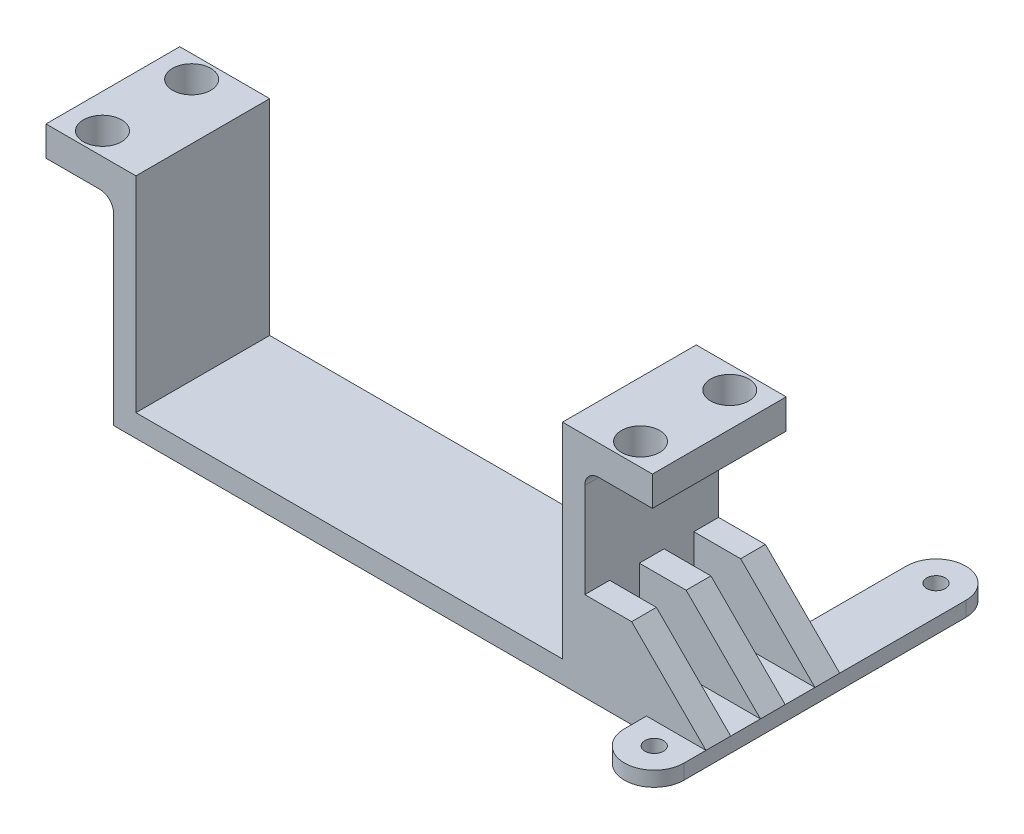
from build123d import *

# Parameters (mm, degrees)
BOSS_EXTRUDE1_DEPTH = 22.86
SKETCH2_R           = 1.5875
BOSS_EXTRUDE2_DEPTH = 2.54
SKETCH4_W           = 15.367
SKETCH4_H           = 22.86
SKETCH4_R           = 3.2639
BOSS_EXTRUDE3_DEPTH = 5.08
SKETCH5_W           = 20.701
SKETCH5_H           = 4.233333333
SKETCH5_H_2         = 4.233333334
BOSS_EXTRUDE4_DEPTH = 12.7
CHAMFER1_SIZE       = 12.7
FILLET1_R           = 2.38


with BuildPart() as part:
    # Sketch1 → Boss-Extrude1 (new body)
    with BuildSketch(Plane.XY):
        Polygon((-3.81, 35.052), (0, 35.052), (0, 0), (72.898, 0), (72.898, 35.052), (76.708, 35.052), (76.708, -3.81), (-3.81, -3.81), align=None)
    extrude(amount=BOSS_EXTRUDE1_DEPTH)

    # Sketch2 → Boss-Extrude2 (add)
    with BuildSketch(Plane.XZ.offset(3.81)):
        with BuildLine():
            Line((87.249, 26.6192), (87.249, 22.86))
            Line((87.249, 22.86), (76.708, 22.86))
            Line((76.708, 22.86), (76.708, 0))
            Line((76.708, 0), (87.249, 0))
            Line((87.249, 0), (87.249, -21.5392))
            ThreePointArc((87.249, -21.5392), (92.329, -26.6192), (97.409, -21.5392))
            Line((97.409, -21.5392), (97.409, 26.6192))
            ThreePointArc((97.409, 26.6192), (92.329, 31.6992), (87.249, 26.6192))
        make_face()
        with Locations((92.329, 26.6192)):
            Circle(SKETCH2_R, mode=Mode.SUBTRACT)
        with Locations((92.329, -21.5392)):
            Circle(SKETCH2_R, mode=Mode.SUBTRACT)
    extrude(amount=-BOSS_EXTRUDE2_DEPTH)

    # Sketch4 → Boss-Extrude3 (add)
    with BuildSketch(Plane(origin=(0, 35.052, 0), x_dir=(1, 0, 0), z_dir=(0, 1, 0))):
        with Locations((-7.6835, -11.43)):
            Rectangle(SKETCH4_W, SKETCH4_H)
        with Locations((-9.525, -3.81)):
            Circle(SKETCH4_R, mode=Mode.SUBTRACT)
        with Locations((-9.525, -19.05)):
            Circle(SKETCH4_R, mode=Mode.SUBTRACT)
    boss_extrude3 = extrude(amount=-BOSS_EXTRUDE3_DEPTH)

    # Mirror1: Boss-Extrude3 across plane
    add(boss_extrude3.mirror(Plane(origin=(36.449, 0, 0), x_dir=(0, 0, 1), z_dir=(1, 0, 0))))

    # Sketch5 → Boss-Extrude4 (add)
    with BuildSketch(Plane(origin=(0, -1.27, 0), x_dir=(1, 0, 0), z_dir=(0, 1, 0))):
        with Locations((87.0585, -2.116666667)):
            Rectangle(SKETCH5_W, SKETCH5_H)
        with Locations((87.0585, -20.743333334)):
            Rectangle(SKETCH5_W, SKETCH5_H)
        with Locations((87.0585, -11.43)):
            Rectangle(SKETCH5_W, SKETCH5_H_2)
    extrude(amount=BOSS_EXTRUDE4_DEPTH)

    # Chamfer1
    chamfer1_edges = [part.edges().sort_by_distance(p)[0] for p in [
        (97.409, 11.43, 20.743333333),
        (97.409, 11.43, 11.43),
        (97.409, 11.43, 2.116666667),
    ]]
    chamfer(chamfer1_edges, length=CHAMFER1_SIZE)

    # Fillet1
    fillet1_edges = [part.edges().sort_by_distance(p)[0] for p in [
        (76.708, 29.972, 11.43),
        (-3.81, 29.972, 11.43),
    ]]
    fillet(fillet1_edges, radius=FILLET1_R)


solid = part.part
